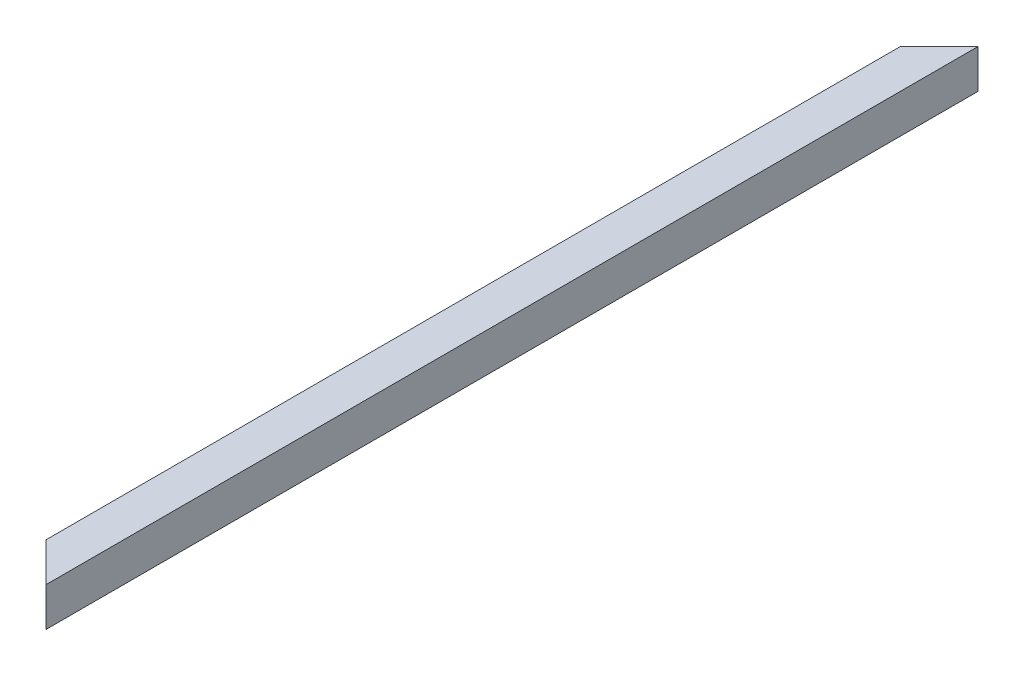
from build123d import *

# Parameters (mm, degrees)
BOSS_EXTRUDE1_DEPTH = 609.6
CHAMFER1_SIZE       = 25.4


with BuildPart() as part:
    # Sketch1 → Boss-Extrude1 (new body)
    with BuildSketch(Plane.XY):
        Polygon((0, 0), (0, -25.4), (-6.35, -25.4), (-6.35, -6.35), (-25.4, -6.35), (-25.4, 0), align=None)
    extrude(amount=BOSS_EXTRUDE1_DEPTH)

    # Chamfer1
    chamfer1_edges = [part.edges().sort_by_distance(p)[0] for p in [
        (-25.4, -3.175, 0),
        (-25.4, -3.175, 609.6),
    ]]
    chamfer(chamfer1_edges, length=CHAMFER1_SIZE - 0.0001)  # a hair under: the kernel refuses the full size


solid = part.part
